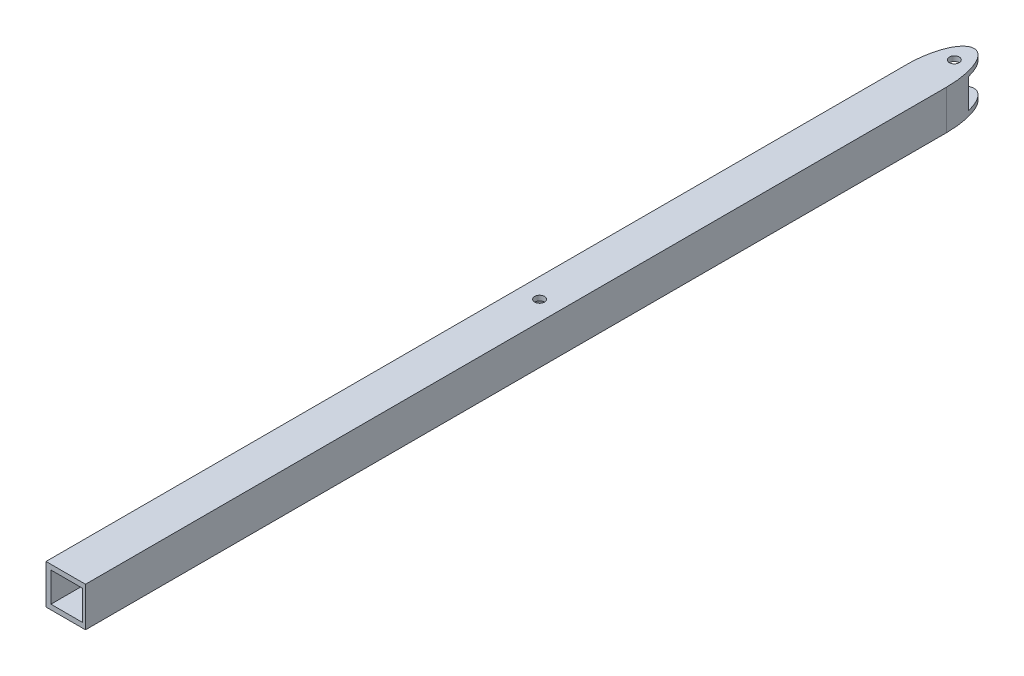
from build123d import *

# Parameters (mm, degrees)
SKETCH1_W           = 25.4
SKETCH1_H           = 25.4
BOSS_EXTRUDE2_DEPTH = 584.2
SKETCH2_W           = 20.302766191
SKETCH2_H           = 19.05
CUT_EXTRUDE1_DEPTH  = 586.303305988
CUT_EXTRUDE2_DEPTH  = 586.303305988
SKETCH6_R           = 3.175
CUT_EXTRUDE5_DEPTH  = 586.303306096
SKETCH4_R           = 3.175
CUT_EXTRUDE6_DEPTH  = 586.303306096


with BuildPart() as part:
    # Sketch1 → Boss-Extrude2 (new body)
    with BuildSketch(Plane.XY):
        with Locations((12.7, 12.7)):
            Rectangle(SKETCH1_W, SKETCH1_H)
    extrude(amount=BOSS_EXTRUDE2_DEPTH)

    # Sketch2 → Cut-Extrude1 (cut, through all)
    with BuildSketch(Plane(origin=(0, 0, 0), x_dir=(-1, 0, 0), z_dir=(0, 0, -1))):
        with Locations((-13.326383096, 12.7)):
            Rectangle(SKETCH2_W, SKETCH2_H)
    extrude(amount=-CUT_EXTRUDE1_DEPTH, mode=Mode.SUBTRACT)

    # Sketch3 → Cut-Extrude2 (cut, through all)
    with BuildSketch(Plane(origin=(0, 25.4, 0), x_dir=(1, 0, 0), z_dir=(0, 1, 0))):
        with BuildLine():
            add(Edge.make_bspline(
                [(12.7, 0), (0, 0), (0, -30.465860076)],
                knots=[6.283185307, 6.283185307, 6.283185307, 7.853981634, 7.853981634, 7.853981634], degree=2, weights=[1, 0.707106781, 1]))
            Line((12.7, 0), (0, 0))
            Line((0, 0), (0, -30.465860076))
        make_face()
        with BuildLine():
            Line((25.4, 0), (12.7, 0))
            add(Edge.make_bspline(
                [(25.4, -30.465860076), (25.4, 0), (12.7, 0)],
                knots=[4.71238898, 4.71238898, 4.71238898, 6.283185307, 6.283185307, 6.283185307], degree=2, weights=[1, 0.707106781, 1]))
            Line((25.4, -30.465860076), (25.4, 0))
        make_face()
    extrude(amount=-CUT_EXTRUDE2_DEPTH, mode=Mode.SUBTRACT)

    # Sketch6 → Cut-Extrude5 (cut, through all)
    with BuildSketch(Plane(origin=(0, 25.4, 0), x_dir=(1, 0, 0), z_dir=(0, 1, 0))):
        with Locations((12.7, -12.7)):
            Circle(SKETCH6_R)
    extrude(amount=-CUT_EXTRUDE5_DEPTH, mode=Mode.SUBTRACT)

    # Sketch4 → Cut-Extrude6 (cut, through all)
    with BuildSketch(Plane(origin=(0, 25.4, 0), x_dir=(1, 0, 0), z_dir=(0, 1, 0))):
        with Locations((12.7, -279.4)):
            Circle(SKETCH4_R)
    extrude(amount=-CUT_EXTRUDE6_DEPTH, mode=Mode.SUBTRACT)


solid = part.part
